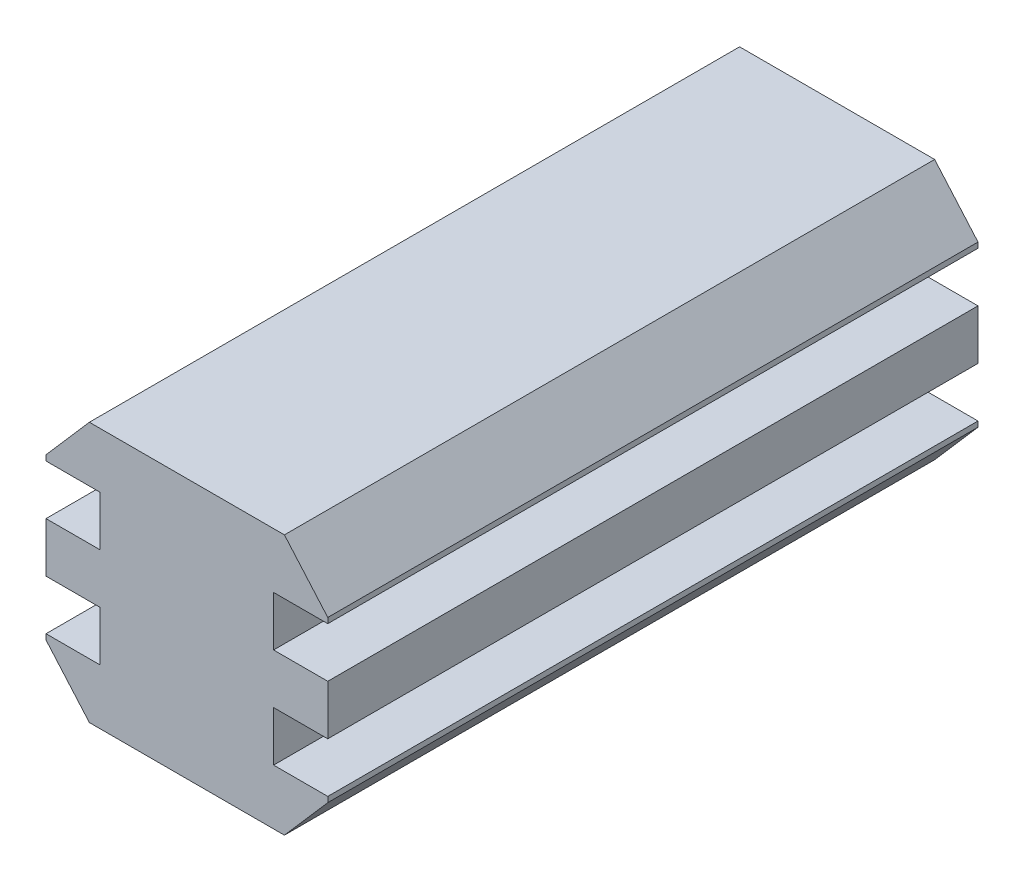
from build123d import *

# Parameters (mm, degrees)
RESSALTO_EXTRUS_O1_DEPTH = 30


with BuildPart() as part:
    # Esboço1 → Ressalto-extrusão1 (new body)
    with BuildSketch(Plane.XY):
        Polygon((-4.5, -6), (4.5, -6), (6.5, -3.7), (6.5, -3.45), (4, -3.45), (4, -1.15), (6.5, -1.15), (6.5, 1.15), (4, 1.15), (4, 3.45), (6.5, 3.45), (6.5, 3.7), (4.5, 6), (-4.5, 6), (-6.5, 3.7), (-6.5, 3.45), (-4, 3.45), (-4, 1.15), (-6.5, 1.15), (-6.5, -1.15), (-4, -1.15), (-4, -3.45), (-6.5, -3.45), (-6.5, -3.7), align=None)
    extrude(amount=RESSALTO_EXTRUS_O1_DEPTH)


solid = part.part
